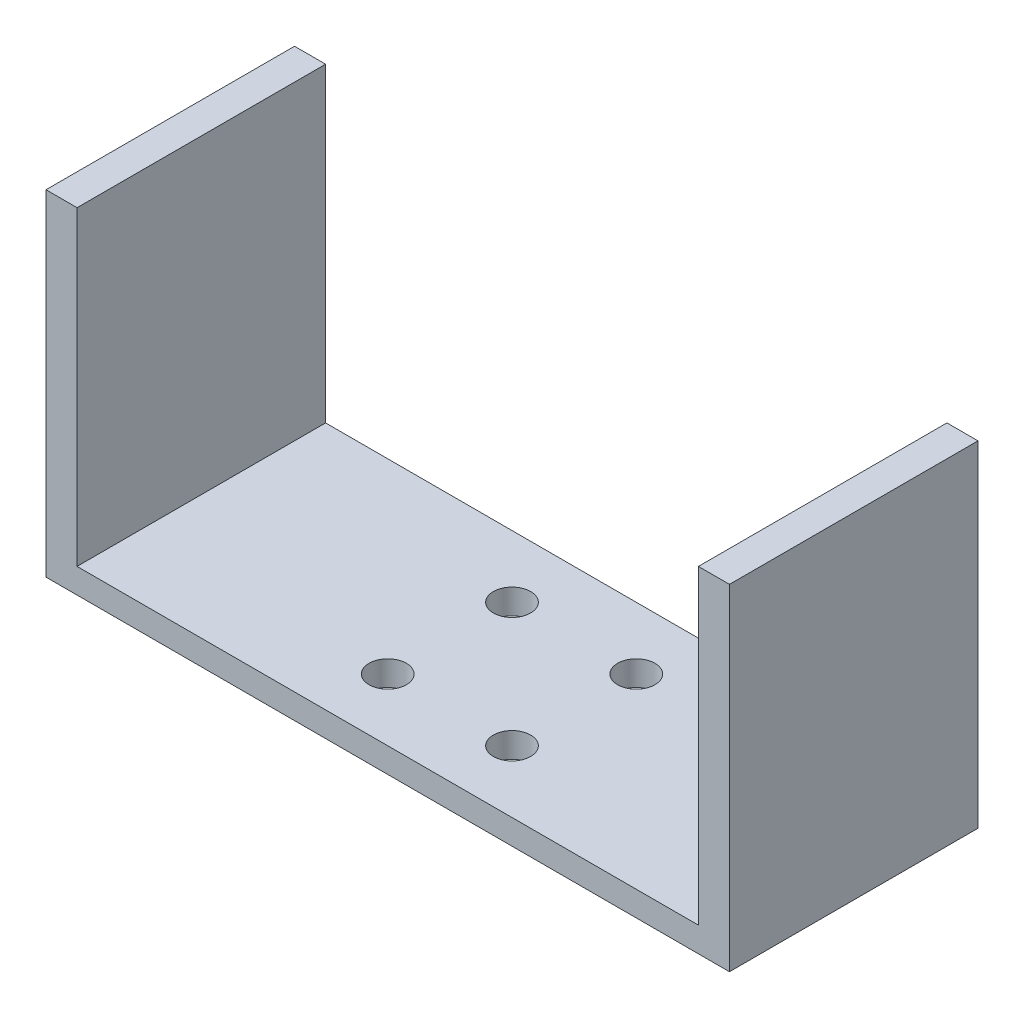
from build123d import *

# Parameters (mm, degrees)
SKETCH1_W           = 55
SKETCH1_H           = 20
BOSS_EXTRUDE1_DEPTH = 2
SKETCH2_W           = 2.5
SKETCH2_H           = 20
BOSS_EXTRUDE2_DEPTH = 25
SKETCH3_R           = 1.5
CUT_EXTRUDE1_DEPTH  = 39.487010796


with BuildPart() as part:
    # Sketch1 → Boss-Extrude1 (new body)
    with BuildSketch(Plane(origin=(0, 0, 0), x_dir=(1, 0, 0), z_dir=(0, 1, 0))):
        Rectangle(SKETCH1_W, SKETCH1_H)
    extrude(amount=BOSS_EXTRUDE1_DEPTH)

    # Sketch2 → Boss-Extrude2 (add)
    with BuildSketch(Plane(origin=(0, 2, 0), x_dir=(1, 0, 0), z_dir=(0, 1, 0))):
        with Locations((-26.25, 0)):
            Rectangle(SKETCH2_W, SKETCH2_H)
        with Locations((26.25, 0)):
            Rectangle(SKETCH2_W, SKETCH2_H)
    extrude(amount=BOSS_EXTRUDE2_DEPTH)

    # Sketch3 → Cut-Extrude1 (cut, through all)
    with BuildSketch(Plane(origin=(0, 2, 0), x_dir=(1, 0, 0), z_dir=(0, 1, 0))):
        with Locations((5, 5)):
            Circle(SKETCH3_R)
        with Locations((-5, 5)):
            Circle(SKETCH3_R)
        with Locations((-5, -5)):
            Circle(SKETCH3_R)
        with Locations((5, -5)):
            Circle(SKETCH3_R)
    extrude(amount=-CUT_EXTRUDE1_DEPTH, mode=Mode.SUBTRACT)


solid = part.part
